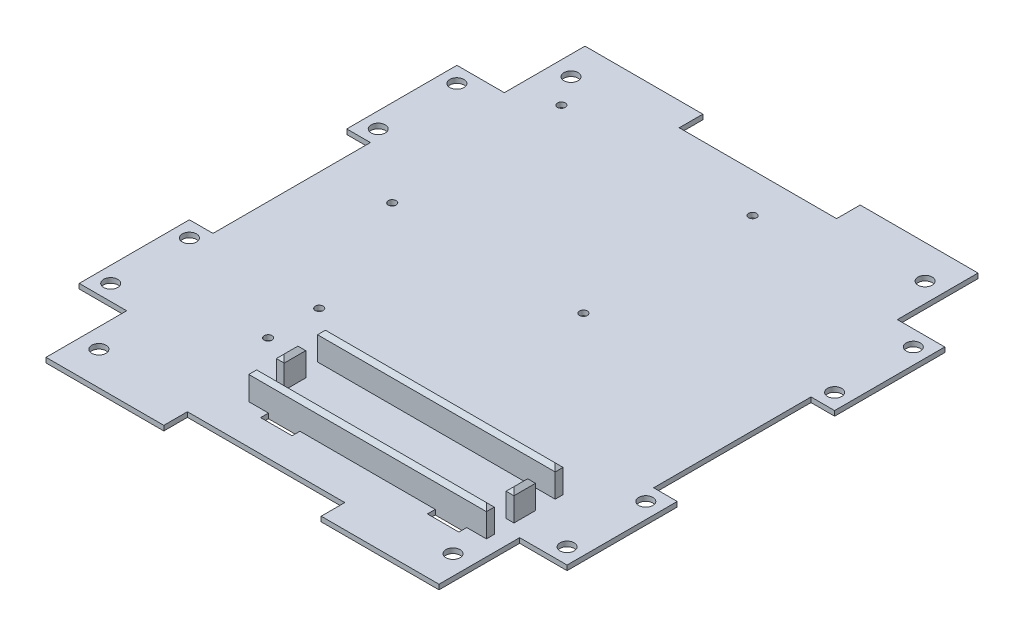
from build123d import *

# Parameters (mm, degrees)
SKETCH1_R           = 2.286
BOSS_EXTRUDE1_DEPTH = 1.5875
SKETCH2_R           = 2.286
CUT_EXTRUDE1_DEPTH  = 118.348360795
SKETCH3_R           = 1.27
CUT_EXTRUDE2_DEPTH  = 118.348360795
SKETCH4_W           = 2.54
SKETCH4_H           = 6.9596
BOSS_EXTRUDE2_DEPTH = 8.89
CHAMFER1_SIZE       = 1.27
SKETCH5_W           = 10.16
SKETCH5_H           = 2.54
CUT_EXTRUDE3_DEPTH  = 118.673912678
SKETCH6_R           = 1.27
CUT_EXTRUDE4_DEPTH  = 8.89


with BuildPart() as part:
    # Sketch1 → Boss-Extrude1 (new body)
    with BuildSketch(Plane(origin=(0, 0, 0), x_dir=(1, 0, 0), z_dir=(0, 1, 0))):
        Polygon((-25.4, 86.995), (-63.43142, 86.995), (-63.43142, 60.96), (-78.74, 60.96), (-78.74, 25.4), (-71.12, 25.4), (-71.12, -25.4), (-78.74, -25.4), (-78.74, -60.96), (-63.43142, -60.96), (-63.43142, -86.995), (-25.4, -86.995), (-25.4, -79.375), (25.4, -79.375), (25.4, -86.995), (63.43142, -86.995), (63.43142, -60.96), (78.74, -60.96), (78.74, -25.4), (71.12, -25.4), (71.12, 25.4), (78.74, 25.4), (78.74, 60.96), (63.43142, 60.96), (63.43142, 86.995), (25.4, 86.995), (25.4, 79.375), (-25.4, 79.375), align=None)
        with Locations(Location((-57.15, 76.2, 0), (0, 0, 270))):
            Circle(SKETCH1_R, mode=Mode.SUBTRACT)
        with Locations(Location((57.15, 76.2, 0), (0, 0, 270))):
            Circle(SKETCH1_R, mode=Mode.SUBTRACT)
        with Locations(Location((57.15, -76.2, 0), (0, 0, 270))):
            Circle(SKETCH1_R, mode=Mode.SUBTRACT)
        with Locations(Location((-57.15, -76.2, 0), (0, 0, 270))):
            Circle(SKETCH1_R, mode=Mode.SUBTRACT)
    extrude(amount=BOSS_EXTRUDE1_DEPTH)

    # Sketch2 → Cut-Extrude1 (cut, through all)
    with BuildSketch(Plane(origin=(0, 1.5875, 0), x_dir=(1, 0, 0), z_dir=(0, 1, 0))):
        with Locations(Location((-73.66, -30.48, 0), (0, 0, 270))):
            Circle(SKETCH2_R)
        with Locations(Location((-73.66, -55.88, 0), (0, 0, 270))):
            Circle(SKETCH2_R)
        with Locations(Location((73.66, -55.88, 0), (0, 0, 90))):
            Circle(SKETCH2_R)
        with Locations(Location((73.66, -30.48, 0), (0, 0, 90))):
            Circle(SKETCH2_R)
        with Locations(Location((73.66, 30.48, 0), (0, 0, 270))):
            Circle(SKETCH2_R)
        with Locations(Location((73.66, 55.88, 0), (0, 0, 270))):
            Circle(SKETCH2_R)
        with Locations(Location((-73.66, 55.88, 0), (0, 0, 90))):
            Circle(SKETCH2_R)
        with Locations(Location((-73.66, 30.48, 0), (0, 0, 90))):
            Circle(SKETCH2_R)
    extrude(amount=-CUT_EXTRUDE1_DEPTH, mode=Mode.SUBTRACT)

    # Sketch3 → Cut-Extrude2 (cut, through all)
    with BuildSketch(Plane(origin=(0, 1.5875, 0), x_dir=(1, 0, 0), z_dir=(0, 1, 0))):
        with Locations(Location((-50.73142, 66.675, 0), (0, 0, 270))):
            Circle(SKETCH3_R)
        with Locations(Location((10.99058, 66.675, 0), (0, 0, 270))):
            Circle(SKETCH3_R)
        with Locations(Location((10.99058, 12.065, 0), (0, 0, 270))):
            Circle(SKETCH3_R)
        with Locations(Location((-50.73142, 12.065, 0), (0, 0, 270))):
            Circle(SKETCH3_R)
    extrude(amount=-CUT_EXTRUDE2_DEPTH, mode=Mode.SUBTRACT)

    # Sketch4 → Boss-Extrude2 (add)
    with BuildSketch(Plane(origin=(0, 1.5875, 0), x_dir=(1, 0, 0), z_dir=(0, 1, 0))):
        Polygon((-15.748, -44.4754), (55.88, -44.4754), (58.42, -44.4754), (58.42, -41.9354), (-18.288, -41.9354), (-18.288, -44.4754), align=None)
        with Locations((-17.018, -54.3052)):
            Rectangle(SKETCH4_W, SKETCH4_H)
        Polygon((-15.748, -64.135), (55.88, -64.135), (58.42, -64.135), (58.42, -66.675), (-18.288, -66.675), (-18.288, -64.135), align=None)
        with Locations((57.15, -54.3052)):
            Rectangle(SKETCH4_W, SKETCH4_H)
    extrude(amount=BOSS_EXTRUDE2_DEPTH)

    # Chamfer1
    chamfer1_edges = [part.edges().sort_by_distance(p)[0] for p in [
        (20.066, 10.4775, 44.4754),
        (58.42, 10.4775, 43.2054),
        (20.066, 10.4775, 41.9354),
        (-18.288, 10.4775, 43.2054),
        (20.066, 10.4775, 64.135),
        (-18.288, 10.4775, 65.405),
        (20.066, 10.4775, 66.675),
        (58.42, 10.4775, 65.405),
        (-17.018, 10.4775, 50.8254),
        (-18.288, 10.4775, 54.3052),
        (-17.018, 10.4775, 57.785),
        (-15.748, 10.4775, 54.3052),
        (58.42, 10.4775, 54.3052),
        (57.15, 10.4775, 50.8254),
        (55.88, 10.4775, 54.3052),
        (57.15, 10.4775, 57.785),
    ]]
    chamfer(chamfer1_edges, length=CHAMFER1_SIZE - 0.0001)  # a hair under: the kernel refuses the full size

    # Sketch5 → Cut-Extrude3 (cut, through all)
    with BuildSketch(Plane(origin=(0, 1.5875, 0), x_dir=(1, 0, 0), z_dir=(0, 1, 0))):
        with Locations((-6.858, -40.6654)):
            Rectangle(SKETCH5_W, SKETCH5_H)
        with Locations((46.99, -40.6654)):
            Rectangle(SKETCH5_W, SKETCH5_H)
        with Locations((46.99, -67.945)):
            Rectangle(SKETCH5_W, SKETCH5_H)
        with Locations((-6.858, -67.945)):
            Rectangle(SKETCH5_W, SKETCH5_H)
    extrude(amount=-CUT_EXTRUDE3_DEPTH, mode=Mode.SUBTRACT)

    # Sketch6 → Cut-Extrude4 (cut)
    with BuildSketch(Plane(origin=(0, 1.5875, 0), x_dir=(1, 0, 0), z_dir=(0, 1, 0))):
        with Locations(Location((-33.02, -29.21, 0), (0, 0, 270))):
            Circle(SKETCH6_R)
        with Locations(Location((-33.02, -45.72, 0), (0, 0, 270))):
            Circle(SKETCH6_R)
    extrude(amount=-CUT_EXTRUDE4_DEPTH, mode=Mode.SUBTRACT)


solid = part.part
